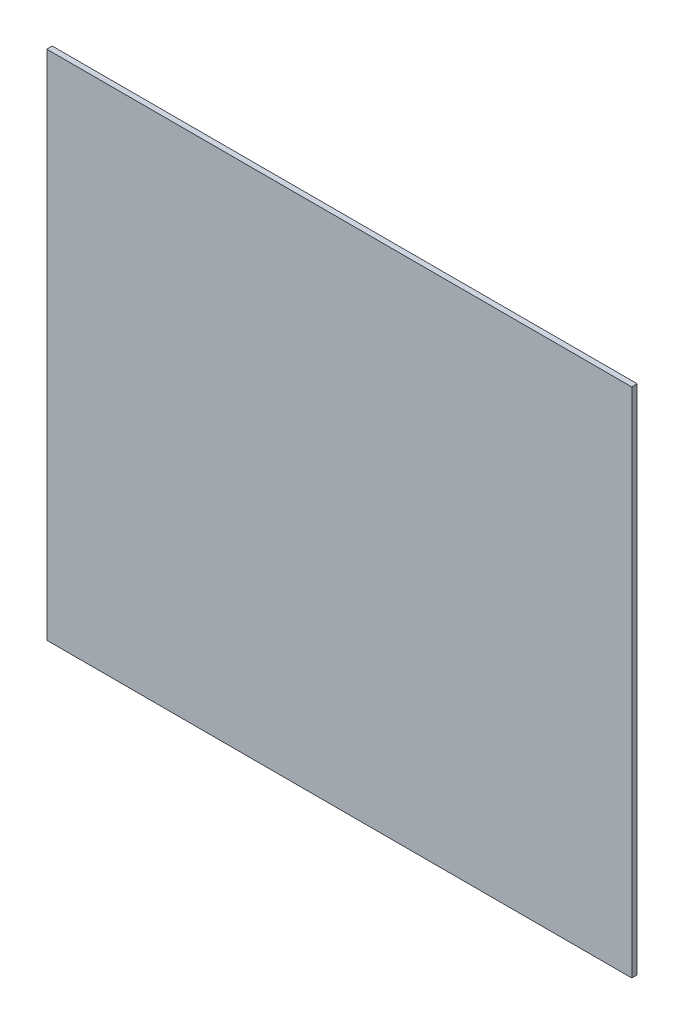
from build123d import *

# Parameters (mm, degrees)
SKETCH1_W           = 320
SKETCH1_H           = 280
BOSS_EXTRUDE1_DEPTH = 3


with BuildPart() as part:
    # Sketch1 → Boss-Extrude1 (new body)
    with BuildSketch(Plane.XY):
        Rectangle(SKETCH1_W, SKETCH1_H)
    extrude(amount=BOSS_EXTRUDE1_DEPTH)


solid = part.part
